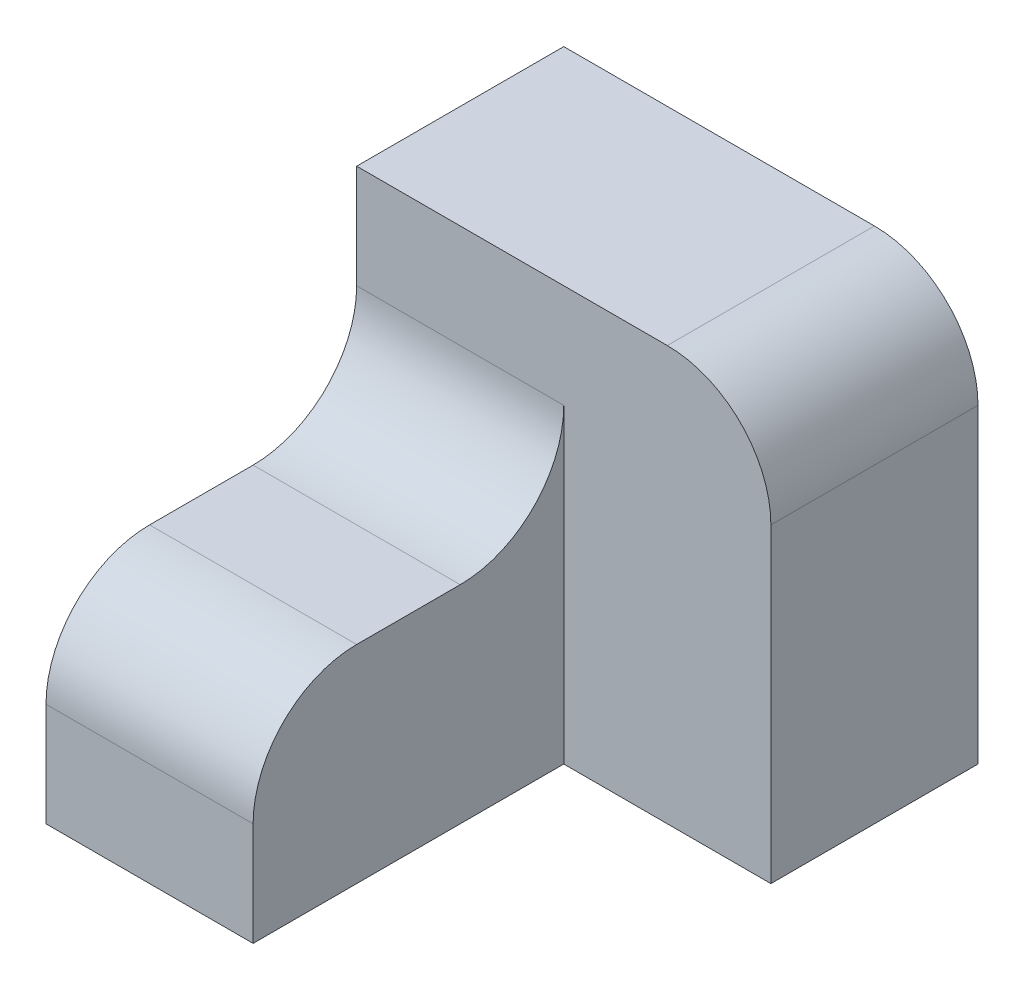
from build123d import *

# Parameters (mm, degrees)
SKETCH1_W           = 20
SKETCH1_H           = 20
BOSS_EXTRUDE1_DEPTH = 30
SKETCH2_W           = 40
SKETCH2_H           = 40
BOSS_EXTRUDE2_DEPTH = 20
FILLET1_R           = 10


with BuildPart() as part:
    # Sketch1 → Boss-Extrude1 (new body)
    with BuildSketch(Plane.XY):
        with Locations((-20, -10)):
            Rectangle(SKETCH1_W, SKETCH1_H)
    extrude(amount=BOSS_EXTRUDE1_DEPTH)

    # Sketch2 → Boss-Extrude2 (add)
    with BuildSketch(Plane.XY):
        with Locations((-10, 0)):
            Rectangle(SKETCH2_W, SKETCH2_H)
    extrude(amount=-BOSS_EXTRUDE2_DEPTH)

    # Fillet1
    fillet1_edges = [part.edges().sort_by_distance(p)[0] for p in [
        (-20, 0, 0),
        (10, 20, -10),
        (-20, 0, 30),
    ]]
    fillet(fillet1_edges, radius=FILLET1_R)


solid = part.part
